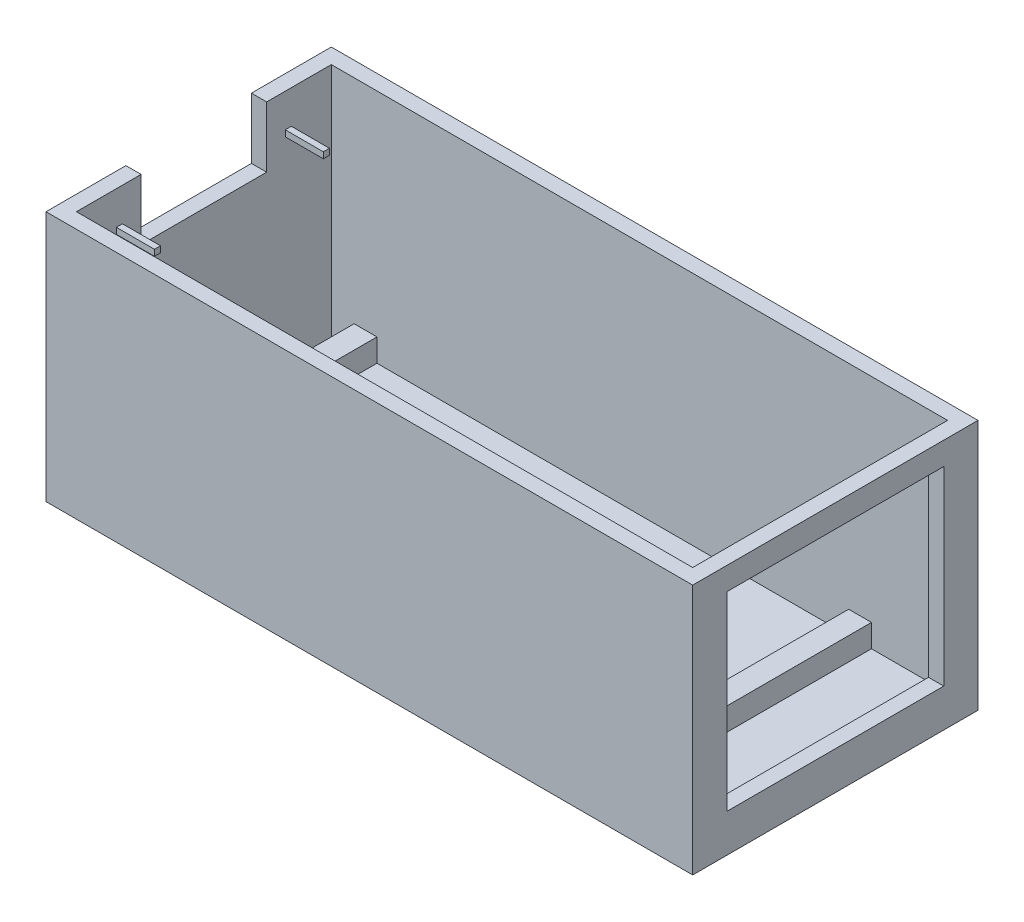
from build123d import *

# Parameters (mm, degrees)
SKETCH1_W           = 85
SKETCH1_H           = 37.5
BOSS_EXTRUDE2_DEPTH = 2
SKETCH2_W           = 3
SKETCH2_H           = 37.5
BOSS_EXTRUDE4_DEPTH = 3
BOSS_EXTRUDE5_DEPTH = 31
SKETCH6_W           = 16.5
SKETCH6_H           = 8
CUT_EXTRUDE1_DEPTH  = 2
SKETCH7_W           = 28.5
SKETCH7_H           = 25
CUT_EXTRUDE2_DEPTH  = 2
SKETCH8_W           = 0.8
SKETCH8_H           = 0.8
BOSS_EXTRUDE6_DEPTH = 5
SKETCH9_W           = 35
SKETCH9_H           = 2
BOSS_EXTRUDE7_DEPTH = 2.4


with BuildPart() as part:
    # Sketch1 → Boss-Extrude2 (new body)
    with BuildSketch(Plane(origin=(0, 0, 0), x_dir=(1, 0, 0), z_dir=(0, 1, 0))):
        with Locations((42.5, 18.75)):
            Rectangle(SKETCH1_W, SKETCH1_H)
    extrude(amount=BOSS_EXTRUDE2_DEPTH)

    # Sketch2 → Boss-Extrude4 (add)
    with BuildSketch(Plane(origin=(0, 2, 0), x_dir=(1, 0, 0), z_dir=(0, 1, 0))):
        with Locations((6.5, 18.75)):
            Rectangle(SKETCH2_W, SKETCH2_H)
        with Locations((71.5, 18.75)):
            Rectangle(SKETCH2_W, SKETCH2_H)
    extrude(amount=BOSS_EXTRUDE4_DEPTH)

    # Sketch4 → Boss-Extrude5 (add)
    with BuildSketch(Plane(origin=(0, 2, 0), x_dir=(1, 0, 0), z_dir=(0, 1, 0))):
        Polygon((8, 37.5), (5, 37.5), (0, 37.5), (0, 0), (5, 0), (8, 0), (70, 0), (73, 0), (85, 0), (85, 37.5), (73, 37.5), (70, 37.5), align=None)
        Polygon((2, 2), (2, 35.5), (5, 35.5), (8, 35.5), (70, 35.5), (73, 35.5), (83, 35.5), (83, 2), (73, 2), (70, 2), (8, 2), (5, 2), align=None, mode=Mode.SUBTRACT)
    extrude(amount=BOSS_EXTRUDE5_DEPTH)

    # Sketch6 → Cut-Extrude1 (cut)
    with BuildSketch(Plane.ZY):
        with Locations((-18.75, 29)):
            Rectangle(SKETCH6_W, SKETCH6_H)
    extrude(amount=-CUT_EXTRUDE1_DEPTH, mode=Mode.SUBTRACT)

    # Sketch7 → Cut-Extrude2 (cut)
    with BuildSketch(Plane(origin=(85, 0, 0), x_dir=(0, 0, -1), z_dir=(1, 0, 0))):
        with Locations((18.75, 17.5)):
            Rectangle(SKETCH7_W, SKETCH7_H)
    extrude(amount=-CUT_EXTRUDE2_DEPTH, mode=Mode.SUBTRACT)

    # Sketch8 → Boss-Extrude6 (add)
    with BuildSketch(Plane(origin=(2, 0, 0), x_dir=(0, 0, -1), z_dir=(1, 0, 0))):
        with Locations((7.65, 28.2)):
            Rectangle(SKETCH8_W, SKETCH8_H)
        with Locations((29.85, 28.2)):
            Rectangle(SKETCH8_W, SKETCH8_H)
    extrude(amount=BOSS_EXTRUDE6_DEPTH)

    # Sketch9 → Boss-Extrude7 (add)
    with BuildSketch(Plane(origin=(0, 0, -37.5), x_dir=(-1, 0, 0), z_dir=(0, 0, -1))):
        with Locations((-55.5, 26)):
            Rectangle(SKETCH9_W, SKETCH9_H)
        with Locations((-55.5, 5)):
            Rectangle(SKETCH9_W, SKETCH9_H)
    extrude(amount=BOSS_EXTRUDE7_DEPTH)


solid = part.part
